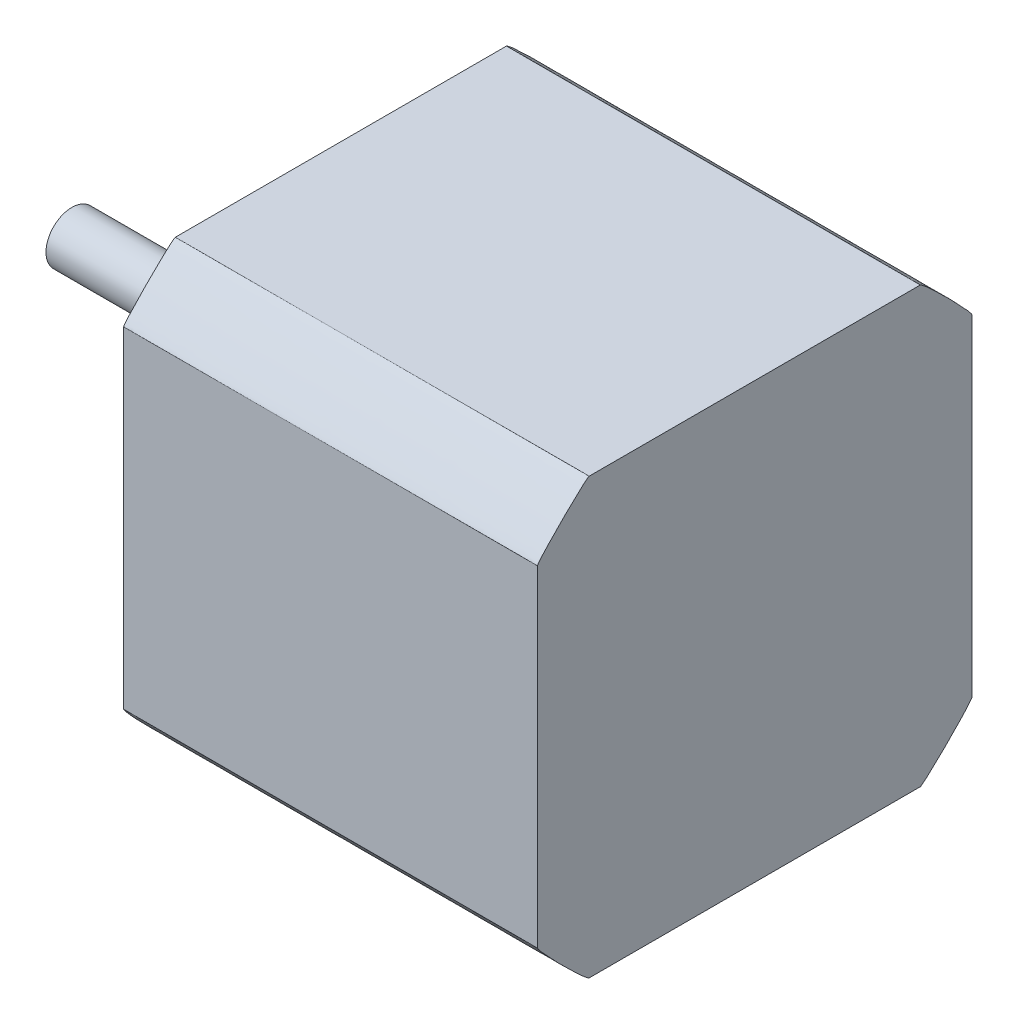
from build123d import *

# Parameters (mm, degrees)
SKETCH1_W           = 42
SKETCH1_H           = 42
BOSS_EXTRUDE1_DEPTH = 40
SKETCH2_R           = 11
BOSS_EXTRUDE2_DEPTH = 2
SKETCH3_R           = 2.5
BOSS_EXTRUDE3_DEPTH = 24
SKETCH4_R           = 1.5
CUT_EXTRUDE1_DEPTH  = 4.5
FILLET1_SIZE        = 5


with BuildPart() as part:
    # Sketch1 → Boss-Extrude1 (new body)
    with BuildSketch(Plane(origin=(0, 0, 0), x_dir=(0, 0, -1), z_dir=(1, 0, 0))):
        with Locations((21, -21)):
            Rectangle(SKETCH1_W, SKETCH1_H)
    extrude(amount=BOSS_EXTRUDE1_DEPTH)

    # Sketch2 → Boss-Extrude2 (add)
    with BuildSketch(Plane.ZY):
        with Locations(Location((-21, -21, 0), (0, 0, 180))):
            Circle(SKETCH2_R)
    extrude(amount=BOSS_EXTRUDE2_DEPTH)

    # Sketch3 → Boss-Extrude3 (add)
    with BuildSketch(Plane.ZY.offset(2)):
        with Locations((-21, -21)):
            Circle(SKETCH3_R)
    extrude(amount=BOSS_EXTRUDE3_DEPTH)

    # Sketch4 → Cut-Extrude1 (cut)
    with BuildSketch(Plane.ZY):
        with Locations((-36.5, -5.5)):
            Circle(SKETCH4_R)
        with Locations((-5.5, -5.5)):
            Circle(SKETCH4_R)
        with Locations((-5.5, -36.5)):
            Circle(SKETCH4_R)
        with Locations((-36.5, -36.5)):
            Circle(SKETCH4_R)
    extrude(amount=-CUT_EXTRUDE1_DEPTH, mode=Mode.SUBTRACT)

    # Fillet1
    # a fillet whose section is not a circle: 5 mm, written as the material it takes off along each edge
    with BuildSketch(Plane(origin=(-12.5, -42, 0), x_dir=(0, 1, 0), z_dir=(1, 0, 0)), Plane(origin=(-12.5, 0, 0), x_dir=(0, 0, -1), z_dir=(1, 0, 0))) as fillet1_piece_1:
        with BuildLine():
            Bezier((FILLET1_SIZE, 0), (0, 0), (0, -FILLET1_SIZE), weights=[1, 0.052631579, 1])
            Line((0, -FILLET1_SIZE), (0, 0))
            Line((0, 0), (FILLET1_SIZE, 0))
        make_face()
    extrude(amount=65, mode=Mode.SUBTRACT)
    with BuildSketch(Plane(origin=(-12.5, -42, -42), x_dir=(0, 1, 0), z_dir=(1, 0, 0)), Plane(origin=(-12.5, 0, -42), x_dir=(0, 0, 1), z_dir=(1, 0, 0))) as fillet1_piece_2:
        with BuildLine():
            Bezier((FILLET1_SIZE, 0), (0, 0), (0, FILLET1_SIZE), weights=[1, 0.052631579, 1])
            Line((0, FILLET1_SIZE), (0, 0))
            Line((0, 0), (FILLET1_SIZE, 0))
        make_face()
    extrude(amount=65, mode=Mode.SUBTRACT)


solid = part.part
